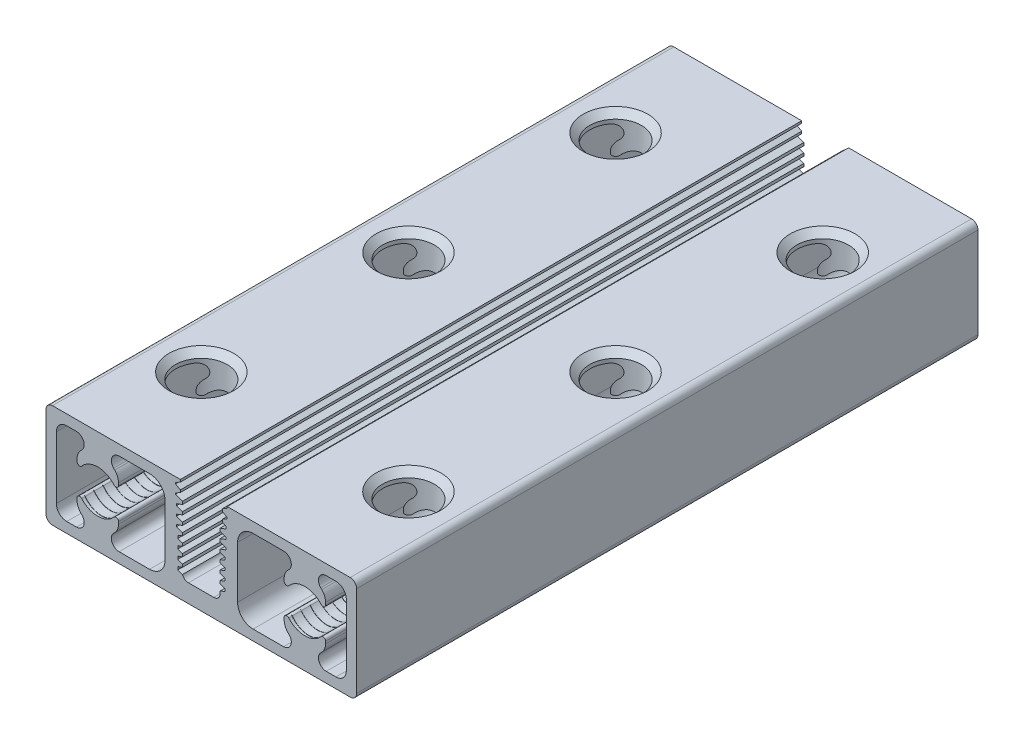
from build123d import *

# Parameters (mm, degrees)
EXTRUDE_1_DEPTH                   = 48
FILLET1_R                         = 0.2
SKETCH1_R                         = 2
CUT_EXTRUDE1_DEPTH                = 51.119856345
CHAMFER1_SIZE                     = 0.5
FILLET_1_R                        = 0.5
FILLET_2_R                        = 1.2
FILLET_3_R                        = 0.8
FILLET_4_R                        = 0.5
PATTERN_LINEAR_1_COUNT            = 3
PATTERN_LINEAR_1_PITCH            = 16
CHAMFER1_OF_PATTERN_LINEAR_1_SIZE = 0.5
SWEEP_1_PITCH                     = 0.7
SWEEP_2_PITCH                     = 0.7


with BuildPart() as part:
    # 草图1 → 凸台-拉伸1 (new body)
    with BuildSketch(Plane.XY):
        Polygon((-1.62, 7.825), (-2, 7.605606898), (-2, 7.519393102), (-1.62, 7.3), (-1.62, 7.125), (-2, 6.905606898), (-2, 6.819393102), (-1.46, 6.622849176), (-1.46, 6.402150824), (-1.92, 6.234724516), (-1.92, 6.090275484), (-1.46, 5.922849176), (-1.46, 5.702150824), (-1.92, 5.534724516), (-1.92, 5.390275484), (-1.46, 5.222849176), (-1.46, 5.002150824), (-1.92, 4.834724516), (-1.92, 4.690275484), (-1.46, 4.522849176), (-1.46, 4.302150824), (-1.82, 4.17112154), (-1.82, 3.95387846), (-1.46, 3.822849176), (-1.46, 3.602150824), (-1.82, 3.47112154), (-1.82, 3.25387846), (-1.46, 3.122849176), (-1.46, 2.902150824), (-1.82, 2.77112154), (-1.82, 2.55387846), (-1.46, 2.422849176), (-1.46, 2.202150824), (-1.82, 2.07112154), (-1.82, 1.85387846), (-1.46, 1.722849176), (-1.46, 1.4), (0, 1.4), (1.46, 1.4), (1.46, 2.083456073), (1.82, 2.214485358), (1.82, 2.431728438), (1.46, 2.562757722), (1.46, 2.783456073), (1.82, 2.914485358), (1.82, 3.131728438), (1.46, 3.262757722), (1.46, 3.483456073), (1.82, 3.614485358), (1.82, 3.831728438), (1.46, 3.962757722), (1.46, 4.183456073), (1.82, 4.314485358), (1.82, 4.531728438), (1.46, 4.662757722), (1.46, 4.883456073), (1.92, 5.050882381), (1.92, 5.195331414), (1.46, 5.362757722), (1.46, 5.583456073), (1.92, 5.750882381), (1.92, 5.895331414), (1.46, 6.062757722), (1.46, 6.283456073), (1.92, 6.450882381), (1.92, 6.612401817), (1.62, 6.785606898), (1.62, 6.960606898), (2, 7.18), (2, 7.266213795), (1.62, 7.485606898), (1.62, 7.660606898), (2, 7.88), (2, 8), (12, 8), (12, 0), (-12, 0), (-12, 8), (-1.62, 8), align=None)
        with BuildLine():
            Line((-9.6, 5.385786438), (-9.6, 4.403112887))
            ThreePointArc((-9.6, 4.403112887), (-8, 5.65), (-6.4, 4.403112887))
            Line((-6.4, 4.403112887), (-6.4, 5.385786438))
            ThreePointArc((-6.4, 5.385786438), (-6.476120467, 5.76846987), (-6.692893219, 6.092893219))
            Line((-6.692893219, 6.092893219), (-6.775735931, 6.175735931))
            ThreePointArc((-6.775735931, 6.175735931), (-6.905799582, 6.829610059), (-6.351471863, 7.2))
            Line((-6.351471863, 7.2), (-6.1, 7.2))
            Line((-6.1, 7.2), (-2.8, 7.2))
            Line((-2.8, 7.2), (-2.8, 0.8))
            Line((-2.8, 0.8), (-6.1, 0.8))
            Line((-6.1, 0.8), (-6.351471863, 0.8))
            ThreePointArc((-6.351471863, 0.8), (-6.905799582, 1.170389941), (-6.775735931, 1.824264069))
            Line((-6.775735931, 1.824264069), (-6.692893219, 1.907106781))
            ThreePointArc((-6.692893219, 1.907106781), (-6.476120467, 2.23153013), (-6.4, 2.614213562))
            Line((-6.4, 2.614213562), (-6.4, 3.596887113))
            ThreePointArc((-6.4, 3.596887113), (-8, 2.35), (-9.6, 3.596887113))
            Line((-9.6, 3.596887113), (-9.6, 2.614213562))
            ThreePointArc((-9.6, 2.614213562), (-9.523879533, 2.23153013), (-9.307106781, 1.907106781))
            Line((-9.307106781, 1.907106781), (-9.224264069, 1.824264069))
            ThreePointArc((-9.224264069, 1.824264069), (-9.094200418, 1.170389941), (-9.648528137, 0.8))
            Line((-9.648528137, 0.8), (-9.9, 0.8))
            Line((-9.9, 0.8), (-11.2, 0.8))
            Line((-11.2, 0.8), (-11.2, 7.2))
            Line((-11.2, 7.2), (-9.9, 7.2))
            Line((-9.9, 7.2), (-9.648528137, 7.2))
            ThreePointArc((-9.648528137, 7.2), (-9.094200418, 6.829610059), (-9.224264069, 6.175735931))
            Line((-9.224264069, 6.175735931), (-9.307106781, 6.092893219))
            ThreePointArc((-9.307106781, 6.092893219), (-9.523879533, 5.76846987), (-9.6, 5.385786438))
        make_face(mode=Mode.SUBTRACT)
        with BuildLine():
            Line((9.9, 0.8), (11.2, 0.8))
            Line((11.2, 0.8), (11.2, 7.2))
            Line((11.2, 7.2), (9.9, 7.2))
            Line((9.9, 7.2), (9.648528137, 7.2))
            ThreePointArc((9.648528137, 7.2), (9.094200418, 6.829610059), (9.224264069, 6.175735931))
            Line((9.224264069, 6.175735931), (9.307106781, 6.092893219))
            ThreePointArc((9.307106781, 6.092893219), (9.523879533, 5.76846987), (9.6, 5.385786438))
            Line((9.6, 5.385786438), (9.6, 4.403112887))
            ThreePointArc((9.6, 4.403112887), (8, 5.65), (6.4, 4.403112887))
            Line((6.4, 4.403112887), (6.4, 5.385786438))
            ThreePointArc((6.4, 5.385786438), (6.476120467, 5.76846987), (6.692893219, 6.092893219))
            Line((6.692893219, 6.092893219), (6.775735931, 6.175735931))
            ThreePointArc((6.775735931, 6.175735931), (6.905799582, 6.829610059), (6.351471863, 7.2))
            Line((6.351471863, 7.2), (6.1, 7.2))
            Line((6.1, 7.2), (2.8, 7.2))
            Line((2.8, 7.2), (2.8, 0.8))
            Line((2.8, 0.8), (6.1, 0.8))
            Line((6.1, 0.8), (6.351471863, 0.8))
            ThreePointArc((6.351471863, 0.8), (6.905799582, 1.170389941), (6.775735931, 1.824264069))
            Line((6.775735931, 1.824264069), (6.692893219, 1.907106781))
            ThreePointArc((6.692893219, 1.907106781), (6.476120467, 2.23153013), (6.4, 2.614213562))
            Line((6.4, 2.614213562), (6.4, 3.596887113))
            ThreePointArc((6.4, 3.596887113), (8, 2.35), (9.6, 3.596887113))
            Line((9.6, 3.596887113), (9.6, 2.614213562))
            ThreePointArc((9.6, 2.614213562), (9.523879533, 2.23153013), (9.307106781, 1.907106781))
            Line((9.307106781, 1.907106781), (9.224264069, 1.824264069))
            ThreePointArc((9.224264069, 1.824264069), (9.094200418, 1.170389941), (9.648528137, 0.8))
            Line((9.648528137, 0.8), (9.9, 0.8))
        make_face(mode=Mode.SUBTRACT)
    extrude(amount=EXTRUDE_1_DEPTH)

    # Fillet1
    fillet1_edges = [part.edges().sort_by_distance(p)[0] for p in [
        (9.6, 4.403112887, 24),
        (6.4, 4.403112887, 24),
        (6.4, 3.596887113, 24),
        (9.6, 3.596887113, 24),
        (-9.6, 3.596887113, 24),
        (-6.4, 3.596887113, 24),
        (-6.4, 4.403112887, 24),
        (-9.6, 4.403112887, 24),
    ]]
    fillet(fillet1_edges, radius=FILLET1_R)

    # Sketch1 → Cut-Extrude1 (cut, through all)
    with BuildSketch(Plane(origin=(0, 8, 0), x_dir=(1, 0, 0), z_dir=(0, 1, 0))):
        with Locations(Location((8, -40, 0), (0, 0, 180))):
            Circle(SKETCH1_R)
        with Locations(Location((-8, -40, 0), (0, 0, 180))):
            Circle(SKETCH1_R)
    cut_extrude1 = extrude(amount=-CUT_EXTRUDE1_DEPTH, mode=Mode.SUBTRACT)

    # Chamfer1
    chamfer1_edges = [part.edges().sort_by_distance(p)[0] for p in [
        (10, 0, 40),
        (10, 8, 40),
        (-6, 0, 40),
        (-6, 8, 40),
    ]]
    chamfer(chamfer1_edges, length=CHAMFER1_SIZE)

    # 圆角1
    fillet_1_edges = [part.edges().sort_by_distance(p)[0] for p in [
        (12, 8, 24),
        (12, 0, 24),
        (-12, 0, 24),
        (-12, 8, 24),
    ]]
    fillet(fillet_1_edges, radius=FILLET_1_R)

    # 圆角2
    fillet_2_edges = [part.edges().sort_by_distance(p)[0] for p in [
        (2.8, 7.2, 24),
        (2.8, 0.8, 24),
        (-2.8, 0.8, 24),
        (-2.8, 7.2, 24),
    ]]
    fillet(fillet_2_edges, radius=FILLET_2_R)

    # 圆角3
    fillet_3_edges = [part.edges().sort_by_distance(p)[0] for p in [
        (11.2, 0.8, 24),
        (11.2, 7.2, 24),
        (-11.2, 7.2, 24),
        (-11.2, 0.8, 24),
    ]]
    fillet(fillet_3_edges, radius=FILLET_3_R)

    # 圆角4
    # the kernel refuses this fillet: 0.5 mm, written as the material it adds along each edge
    with BuildSketch(Plane(origin=(-1.46, 1.4, 0), x_dir=(1, 0, 0), z_dir=(0, 0, 1))) as fillet_4_piece_1:
        with BuildLine():
            CenterArc((0.467565595, 0.5), FILLET_4_R, 200.750650103, 69.249349897)
            Line((0, 0.322849176), (-0.009351312, 0.319306159))
            ThreePointArc((-0.009351312, 0.319306159), (-0.01, 0.161424588), (-0.01, 0))
            Line((-0.01, 0), (0, -0.01))
            Line((0, -0.01), (0.467565595, -0.01))
            Line((0.467565595, -0.01), (0.467565595, 0))
        make_face()
    extrude(amount=48)
    with BuildSketch(Plane(origin=(1.46, 1.4, 0), x_dir=(0, 1, 0), z_dir=(0, 0, 1))) as fillet_4_piece_2:
        with BuildLine():
            CenterArc((FILLET_4_R, FILLET_4_R), FILLET_4_R, 180, 90)
            Line((0, FILLET_4_R), (-FILLET_4_R * 0.02, FILLET_4_R))
            Line((-FILLET_4_R * 0.02, FILLET_4_R), (-FILLET_4_R * 0.02, -FILLET_4_R * 0.02))
            Line((-FILLET_4_R * 0.02, -FILLET_4_R * 0.02), (FILLET_4_R, -FILLET_4_R * 0.02))
            Line((FILLET_4_R, -FILLET_4_R * 0.02), (FILLET_4_R, 0))
        make_face()
    extrude(amount=48)

    # 阵列(线性)1: Cut-Extrude1 ×3
    with Locations(*[(0, 0, -i * PATTERN_LINEAR_1_PITCH) for i in range(1, PATTERN_LINEAR_1_COUNT)]):
        add(cut_extrude1, mode=Mode.SUBTRACT)

    # Chamfer1 of 阵列(线性)1
    chamfer1_of_pattern_linear_1_edges = [part.edges().sort_by_distance(p)[0] for p in [
        (10, 0, 24),
        (10, 8, 24),
        (-6, 0, 24),
        (-6, 8, 24),
        (10, 0, 8),
        (10, 8, 8),
        (-6, 0, 8),
        (-6, 8, 8),
    ]]
    chamfer(chamfer1_of_pattern_linear_1_edges, length=CHAMFER1_OF_PATTERN_LINEAR_1_SIZE)

    # 切除-扫描1: the profile of 草图4 screwed along a right-hand helix of 8.571429 turns, 6 arcs to a turn; built about Z, then put on its axis
    sweep_1_z = Axis((0, 0, 0), (0, 0, 1))
    sweep_1_corners = [(1.64, 0, 0), (1.65, 0, 0.01), (1.66, 0, 0), (1.65, 0, -0.01)]
    with BuildLine(mode=Mode.PRIVATE) as sweep_1_profile:
        ThreePointArc((1.64, 0, 0), (1.642928932, 0, 0.007071068), (1.65, 0, 0.01))
        ThreePointArc((1.65, 0, 0.01), (1.657071068, 0, 0.007071068), (1.66, 0, 0))
        ThreePointArc((1.66, 0, 0), (1.657071068, 0, -0.007071068), (1.65, 0, -0.01))
        ThreePointArc((1.65, 0, -0.01), (1.642928932, 0, -0.007071068), (1.64, 0, 0))
    sweep_1_cap = Face(sweep_1_profile.wire())
    sweep_1_arcs = [((1.64, 0, 0), (1.64, 0, 0.01), (1.65, 0, 0.01), (1, 0.7071067811865476, 1)), ((1.65, 0, 0.01), (1.66, 0, 0.01), (1.66, 0, 0), (1, 0.7071067811865476, 1)), ((1.66, 0, 0), (1.66, 0, -0.01), (1.65, 0, -0.01), (1, 0.7071067811865476, 1)), ((1.65, 0, -0.01), (1.64, 0, -0.01), (1.64, 0, 0), (1, 0.7071067811865476, 1))]  # start, shoulder, end, weights
    sweep_1_turn_angles = [0, 30, 60, 90, 120, 150, 180, 210, 240, 270, 300, 330, 360]
    sweep_1_turn_weights = [1, 0.8660254037844387, 1, 0.8660254037844387, 1, 0.8660254037844387, 1, 0.8660254037844387, 1, 0.8660254037844387, 1, 0.8660254037844387, 1]
    sweep_1_turn_sides = [Face.make_bezier_surface([[Vector(p[j][0], p[j][1], 0).rotate(sweep_1_z, sweep_1_turn_angles[2 * i + k]) / sweep_1_turn_weights[2 * i + k] + Vector(0, 0, p[j][2] + SWEEP_1_PITCH * sweep_1_turn_angles[2 * i + k] / 360) for k in range(3)] for j in range(3)], [[p[3][j] * sweep_1_turn_weights[2 * i + k] for k in range(3)] for j in range(3)]) for p in sweep_1_arcs for i in range(6)]
    sweep_1_last_angles = [2880, 2910, 2940, 2970, 3000, 3030, 3060, 3072.857142857, 3085.714285714]
    sweep_1_last_weights = [1, 0.8660254037844387, 1, 0.8660254037844387, 1, 0.8660254037844387, 1, 0.9749279121818412, 1]
    sweep_1_last_sides = [Face.make_bezier_surface([[Vector(p[j][0], p[j][1], 0).rotate(sweep_1_z, sweep_1_last_angles[2 * i + k]) / sweep_1_last_weights[2 * i + k] + Vector(0, 0, p[j][2] + SWEEP_1_PITCH * sweep_1_last_angles[2 * i + k] / 360) for k in range(3)] for j in range(3)], [[p[3][j] * sweep_1_last_weights[2 * i + k] for k in range(3)] for j in range(3)]) for p in sweep_1_arcs for i in range(4)]
    sweep_1 = Plane(origin=(-8, 4, 48), x_dir=(1, 0, 0), z_dir=(0, 0, -1)) * Solid(Shell([*[p.moved(Location((0, 0, SWEEP_1_PITCH * i))) for i in range(8) for p in sweep_1_turn_sides], *sweep_1_last_sides, sweep_1_cap, sweep_1_cap.rotate(sweep_1_z, 3085.714285714).moved(Location((0, 0, SWEEP_1_PITCH * 3085.714285714 / 360)))]))
    add(sweep_1, mode=Mode.SUBTRACT)

    # 切除-扫描2: the profile of 草图5 screwed along a right-hand helix of 8.571429 turns, 6 arcs to a turn; built about Z, then put on its axis
    sweep_2_z = Axis((0, 0, 0), (0, 0, 1))
    sweep_2_corners = [(1.64, 0, 0), (1.65, 0, 0.01), (1.66, 0, 0), (1.65, 0, -0.01)]
    with BuildLine(mode=Mode.PRIVATE) as sweep_2_profile:
        ThreePointArc((1.64, 0, 0), (1.642928932, 0, 0.007071068), (1.65, 0, 0.01))
        ThreePointArc((1.65, 0, 0.01), (1.657071068, 0, 0.007071068), (1.66, 0, 0))
        ThreePointArc((1.66, 0, 0), (1.657071068, 0, -0.007071068), (1.65, 0, -0.01))
        ThreePointArc((1.65, 0, -0.01), (1.642928932, 0, -0.007071068), (1.64, 0, 0))
    sweep_2_cap = Face(sweep_2_profile.wire())
    sweep_2_arcs = [((1.64, 0, 0), (1.64, 0, 0.01), (1.65, 0, 0.01), (1, 0.7071067811865476, 1)), ((1.65, 0, 0.01), (1.66, 0, 0.01), (1.66, 0, 0), (1, 0.7071067811865476, 1)), ((1.66, 0, 0), (1.66, 0, -0.01), (1.65, 0, -0.01), (1, 0.7071067811865476, 1)), ((1.65, 0, -0.01), (1.64, 0, -0.01), (1.64, 0, 0), (1, 0.7071067811865476, 1))]  # start, shoulder, end, weights
    sweep_2_turn_angles = [0, 30, 60, 90, 120, 150, 180, 210, 240, 270, 300, 330, 360]
    sweep_2_turn_weights = [1, 0.8660254037844387, 1, 0.8660254037844387, 1, 0.8660254037844387, 1, 0.8660254037844387, 1, 0.8660254037844387, 1, 0.8660254037844387, 1]
    sweep_2_turn_sides = [Face.make_bezier_surface([[Vector(p[j][0], p[j][1], 0).rotate(sweep_2_z, sweep_2_turn_angles[2 * i + k]) / sweep_2_turn_weights[2 * i + k] + Vector(0, 0, p[j][2] + SWEEP_2_PITCH * sweep_2_turn_angles[2 * i + k] / 360) for k in range(3)] for j in range(3)], [[p[3][j] * sweep_2_turn_weights[2 * i + k] for k in range(3)] for j in range(3)]) for p in sweep_2_arcs for i in range(6)]
    sweep_2_last_angles = [2880, 2910, 2940, 2970, 3000, 3030, 3060, 3072.857142857, 3085.714285714]
    sweep_2_last_weights = [1, 0.8660254037844387, 1, 0.8660254037844387, 1, 0.8660254037844387, 1, 0.9749279121818358, 1]
    sweep_2_last_sides = [Face.make_bezier_surface([[Vector(p[j][0], p[j][1], 0).rotate(sweep_2_z, sweep_2_last_angles[2 * i + k]) / sweep_2_last_weights[2 * i + k] + Vector(0, 0, p[j][2] + SWEEP_2_PITCH * sweep_2_last_angles[2 * i + k] / 360) for k in range(3)] for j in range(3)], [[p[3][j] * sweep_2_last_weights[2 * i + k] for k in range(3)] for j in range(3)]) for p in sweep_2_arcs for i in range(4)]
    sweep_2 = Plane(origin=(8, 4, 48), x_dir=(1, 0, 0), z_dir=(0, 0, -1)) * Solid(Shell([*[p.moved(Location((0, 0, SWEEP_2_PITCH * i))) for i in range(8) for p in sweep_2_turn_sides], *sweep_2_last_sides, sweep_2_cap, sweep_2_cap.rotate(sweep_2_z, 3085.714285714).moved(Location((0, 0, SWEEP_2_PITCH * 3085.714285714 / 360)))]))
    add(sweep_2, mode=Mode.SUBTRACT)

    # 镜向1: 切除-扫描1, 切除-扫描2 across plane
    add(sweep_1.mirror(Plane.XY.offset(24)), mode=Mode.SUBTRACT)
    add(sweep_2.mirror(Plane.XY.offset(24)), mode=Mode.SUBTRACT)


solid = part.part
